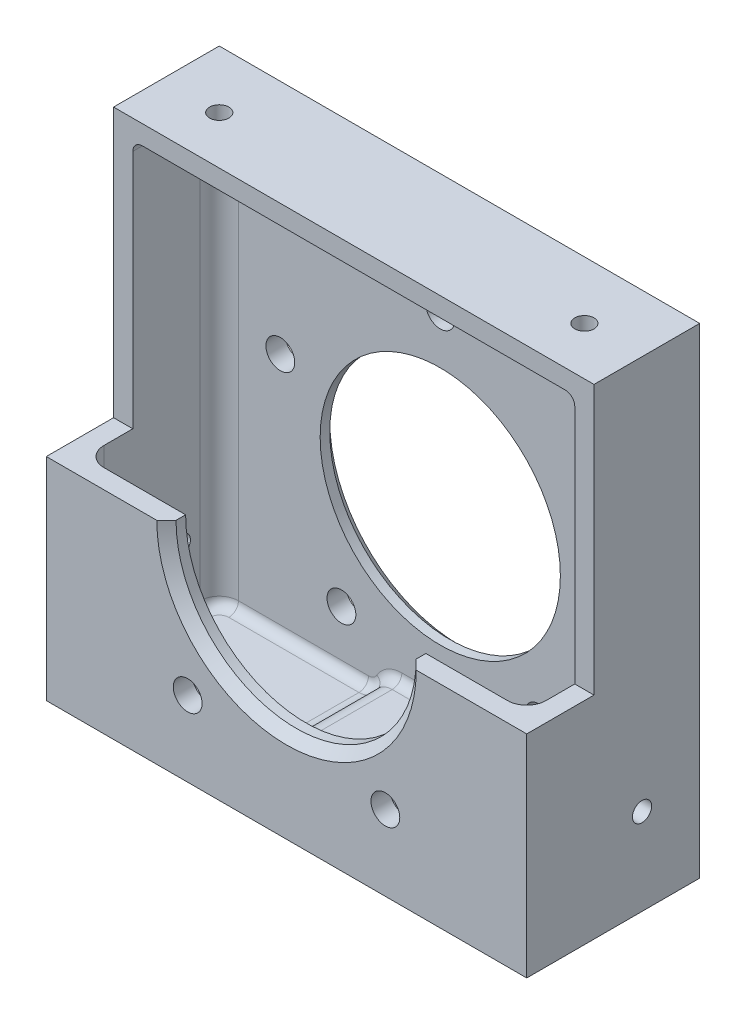
from build123d import *

# Parameters (mm, degrees)
SKETCH1_W          = 50
SKETCH1_H          = 50
MAIN_DEPTH         = 18
SKETCH2_W          = 7
SKETCH2_H          = 28
CUT_EXTRUDE1_DEPTH = 73.965745388
SHELL1_T           = -2
RIB1_REACH         = 72.285
SKETCH11_WALLS_W   = 12
SKETCH11_WALLS_H   = 158.570267126
SKETCH3_R          = 12.5
CUT_EXTRUDE2_DEPTH = 73.965745388
CHAMFER1_SIZE      = 1
CUT_EXTRUDE3_REACH = 74.966
SKETCH4_R          = 1
SKETCH6_R          = 1
CUT_EXTRUDE4_DEPTH = 73.965745388
CUT_EXTRUDE7_REACH = 74.966
SKETCH9_R          = 1.5
CIRPATTERN1_COUNT  = 5
CUT_EXTRUDE8_REACH = 74.966
SKETCH13_R         = 1.5
FILLET1_R          = 2
FILLET2_R          = 2
FILLET4_R          = 2
FILLET5_R          = 2
FILLET6_R          = 2
FILLET3_R          = 1


with BuildPart() as part:
    # Sketch1 → main (new body)
    with BuildSketch(Plane.XY):
        with Locations((25, 25)):
            Rectangle(SKETCH1_W, SKETCH1_H)
    extrude(amount=MAIN_DEPTH)

    # Sketch2 → Cut-Extrude1 (cut, through all)
    with BuildSketch(Plane(origin=(50, 0, 0), x_dir=(0, 0, -1), z_dir=(1, 0, 0))):
        with Locations((-14.5, 36)):
            Rectangle(SKETCH2_W, SKETCH2_H)
    extrude(amount=-CUT_EXTRUDE1_DEPTH, mode=Mode.SUBTRACT)

    # Shell1
    shell1_openings = [part.faces().sort_by_distance(p)[0] for p in [
        (25, 36, 11),
        (25, 22, 14.5),
    ]]
    offset(amount=SHELL1_T, openings=shell1_openings, kind=Kind.INTERSECTION)

    # Sketch11 walls → Rib1 (add, up to next)
    with BuildSketch(Plane(origin=(0, 4, 0), x_dir=(-1, 0, 0), z_dir=(0, 1, 0)), mode=Mode.PRIVATE) as rib1_sk1:
        with Locations((-25, 8)):
            Rectangle(SKETCH11_WALLS_W, SKETCH11_WALLS_H)
    rib1_tool1 = extrude(rib1_sk1.sketch, amount=-RIB1_REACH, mode=Mode.PRIVATE) - part.part
    add(rib1_tool1.solids().sort_by_distance((25, 4, 8))[0])

    # Sketch3 → Cut-Extrude2 (cut, through all)
    with BuildSketch(Plane.XY.offset(18)):
        with Locations((25, 22)):
            Circle(SKETCH3_R)
    extrude(amount=-CUT_EXTRUDE2_DEPTH, mode=Mode.SUBTRACT)

    # Chamfer1
    chamfer1_edges = [part.edges().sort_by_distance(p)[0] for p in [
        (12.5, 22, 0),
        (25, 9.5, 18),
    ]]
    chamfer(chamfer1_edges, length=CHAMFER1_SIZE)

    # Sketch4 → Cut-Extrude3 (cut, up to next)
    with BuildSketch(Plane(origin=(0, 50, 0), x_dir=(-1, 0, 0), z_dir=(0, 1, 0)), mode=Mode.PRIVATE) as cut_extrude3_sk1:
        with Locations((-44, 6)):
            Circle(SKETCH4_R)
    cut_extrude3_tool1 = extrude(cut_extrude3_sk1.sketch, amount=-CUT_EXTRUDE3_REACH, mode=Mode.PRIVATE) & part.part
    # Sketch4 → Cut-Extrude3 (cut, up to next)
    with BuildSketch(Plane(origin=(0, 50, 0), x_dir=(-1, 0, 0), z_dir=(0, 1, 0)), mode=Mode.PRIVATE) as cut_extrude3_sk2:
        with Locations(Location((-6, 6, 0), (0, 0, 180))):
            Circle(SKETCH4_R)
    cut_extrude3_tool2 = extrude(cut_extrude3_sk2.sketch, amount=-CUT_EXTRUDE3_REACH, mode=Mode.PRIVATE) & part.part
    add(cut_extrude3_tool1.solids().sort_by_distance((44, 50, 6))[0], mode=Mode.SUBTRACT)
    add(cut_extrude3_tool2.solids().sort_by_distance((6, 50, 6))[0], mode=Mode.SUBTRACT)

    # Sketch6 → Cut-Extrude4 (cut, through all)
    with BuildSketch(Plane(origin=(50, 0, 0), x_dir=(0, 0, -1), z_dir=(1, 0, 0))):
        with Locations(Location((-6, 9, 0), (0, 0, 90))):
            Circle(SKETCH6_R)
    extrude(amount=-CUT_EXTRUDE4_DEPTH, mode=Mode.SUBTRACT)

    # Sketch9 → Cut-Extrude7 (cut, up to next)
    with BuildSketch(Plane(origin=(0, 0, 0), x_dir=(-1, 0, 0), z_dir=(0, 0, -1)), mode=Mode.PRIVATE) as cut_extrude7_sk1:
        with Locations((-25, 39.5)):
            Circle(SKETCH9_R)
    cut_extrude7_tool1 = extrude(cut_extrude7_sk1.sketch, amount=-CUT_EXTRUDE7_REACH, mode=Mode.PRIVATE) & part.part
    cut_extrude7 = cut_extrude7_tool1.solids().sort_by_distance((25, 39.5, 0))[0]
    add(cut_extrude7, mode=Mode.SUBTRACT)

    # CirPattern1: Cut-Extrude7 ×5 about axis
    cirpattern1_axis = Axis((25, 22, 0), (0, 0, 1))
    for i in range(1, CIRPATTERN1_COUNT):
        add(cut_extrude7.rotate(cirpattern1_axis, i * 360 / CIRPATTERN1_COUNT), mode=Mode.SUBTRACT)

    # Sketch13 → Cut-Extrude8 (cut, up to next)
    with BuildSketch(Plane.XY.offset(18), mode=Mode.PRIVATE) as cut_extrude8_sk1:
        with Locations(Location((35.286241915, 7.842202598, 0), (0, 0, 180))):
            Circle(SKETCH13_R)
    cut_extrude8_tool1 = extrude(cut_extrude8_sk1.sketch, amount=-CUT_EXTRUDE8_REACH, mode=Mode.PRIVATE) & part.part
    # Sketch13 → Cut-Extrude8 (cut, up to next)
    with BuildSketch(Plane.XY.offset(18), mode=Mode.PRIVATE) as cut_extrude8_sk2:
        with Locations(Location((14.713758085, 7.842202598, 0), (0, 0, 180))):
            Circle(SKETCH13_R)
    cut_extrude8_tool2 = extrude(cut_extrude8_sk2.sketch, amount=-CUT_EXTRUDE8_REACH, mode=Mode.PRIVATE) & part.part
    add(cut_extrude8_tool1.solids().sort_by_distance((35.286242, 7.842203, 18))[0], mode=Mode.SUBTRACT)
    add(cut_extrude8_tool2.solids().sort_by_distance((14.713758, 7.842203, 18))[0], mode=Mode.SUBTRACT)

    # Fillet1
    fillet1_edges = [part.edges().sort_by_distance(p)[0] for p in [
        (2, 12, 16),
        (48, 12, 16),
        (2, 25, 2),
        (48, 25, 2),
    ]]
    fillet(fillet1_edges, radius=FILLET1_R)

    # Fillet2
    fillet2_edges = [part.edges().sort_by_distance(p)[0] for p in [
        (31, 2, 9),
    ]]
    fillet(fillet2_edges, radius=FILLET2_R - 0.0001)  # a hair under: the kernel refuses the full size

    # Fillet4
    fillet4_edges = [part.edges().sort_by_distance(p)[0] for p in [
        (31, 4, 9),
    ]]
    fillet(fillet4_edges, radius=FILLET4_R)

    # Fillet5
    fillet5_edges = [part.edges().sort_by_distance(p)[0] for p in [
        (19, 4, 9),
    ]]
    fillet(fillet5_edges, radius=FILLET5_R - 0.0001)  # a hair under: the kernel refuses the full size

    # Fillet6
    fillet6_edges = [part.edges().sort_by_distance(p)[0] for p in [
        (19, 2, 9),
    ]]
    fillet(fillet6_edges, radius=FILLET6_R)

    # Fillet3
    fillet3_edges = [part.edges().sort_by_distance(p)[0] for p in [
        (48, 2, 9),
        (47.414213562, 2, 15.414213562),
        (47.414213562, 2, 2.585786438),
        (10.76792806, 2, 2),
        (25, 48, 2),
        (2.585786438, 48, 2.585786438),
        (47.414213562, 48, 2.585786438),
        (10.76792806, 2, 16),
        (2, 2, 9),
        (2.585786438, 2, 2.585786438),
        (2.585786438, 2, 15.414213562),
        (39.49995, 2, 2),
        (39.49995, 2, 16),
        (31.9999375, 2.267943012, 16),
        (31.9999375, 2.267943012, 2),
        (30.535868621, 3.73204359, 2),
        (30.535868621, 3.73204359, 16),
        (25.26787806, 4, 16),
        (25.26787806, 4, 2),
        (19.9999375, 3.732056988, 16),
        (19.9999375, 3.732056988, 2),
        (18.535868621, 2.26795641, 16),
        (18.535868621, 2.26795641, 2),
        (2, 48, 7.5),
        (48, 48, 7.5),
    ]]
    fillet(fillet3_edges, radius=FILLET3_R)


solid = part.part
